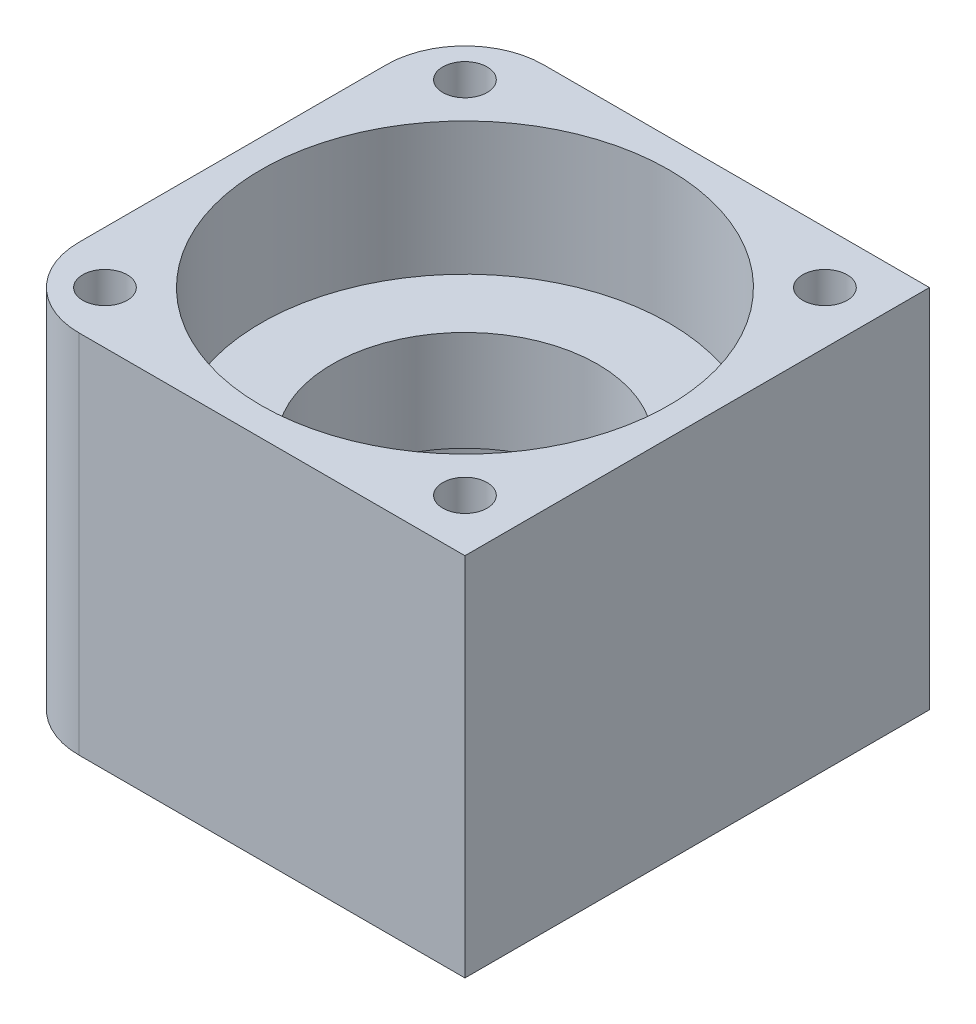
from build123d import *

# Parameters (mm, degrees)
SKETCH1_W           = 88.9
SKETCH1_H           = 88.9
SKETCH1_R           = 4.25
BOSS_EXTRUDE1_DEPTH = 70
SKETCH2_R           = 25.4
CUT_EXTRUDE1_DEPTH  = 70
SKETCH3_R           = 39.05
CUT_EXTRUDE2_DEPTH  = 25.4
CUT_EXTRUDE3_START  = -25.4
SKETCH4_R           = 39.05
CUT_EXTRUDE3_DEPTH  = 25.4
FILLET1_R           = 15


with BuildPart() as part:
    # Sketch1 → Boss-Extrude1 (new body)
    with BuildSketch(Plane(origin=(0, 0, 0), x_dir=(1, 0, 0), z_dir=(0, 1, 0))):
        with Locations((44.45, 44.45)):
            Rectangle(SKETCH1_W, SKETCH1_H)
        with Locations((78.9, 10)):
            Circle(SKETCH1_R, mode=Mode.SUBTRACT)
        with Locations((78.9, 78.9)):
            Circle(SKETCH1_R, mode=Mode.SUBTRACT)
        with Locations((10, 78.9)):
            Circle(SKETCH1_R, mode=Mode.SUBTRACT)
        with Locations((10, 10)):
            Circle(SKETCH1_R, mode=Mode.SUBTRACT)
    extrude(amount=BOSS_EXTRUDE1_DEPTH)

    # Sketch2 → Cut-Extrude1 (cut)
    with BuildSketch(Plane(origin=(0, 70, 0), x_dir=(1, 0, 0), z_dir=(0, 1, 0))):
        with Locations((44.45, 44.45)):
            Circle(SKETCH2_R)
    extrude(amount=-CUT_EXTRUDE1_DEPTH, mode=Mode.SUBTRACT)

    # Sketch3 → Cut-Extrude2 (cut)
    with BuildSketch(Plane(origin=(0, 70, 0), x_dir=(1, 0, 0), z_dir=(0, 1, 0))):
        with Locations((44.45, 44.45)):
            Circle(SKETCH3_R)
    extrude(amount=-CUT_EXTRUDE2_DEPTH, mode=Mode.SUBTRACT)

    # Sketch4 → Cut-Extrude3 (cut)
    with BuildSketch(Plane.XZ.offset(CUT_EXTRUDE3_START)):
        with Locations((44.45, -44.45)):
            Circle(SKETCH4_R)
    extrude(amount=CUT_EXTRUDE3_DEPTH, mode=Mode.SUBTRACT)

    # Fillet1
    fillet1_edges = [part.edges().sort_by_distance(p)[0] for p in [
        (0, 35, 0),
        (0, 35, -88.9),
    ]]
    fillet(fillet1_edges, radius=FILLET1_R)


solid = part.part
